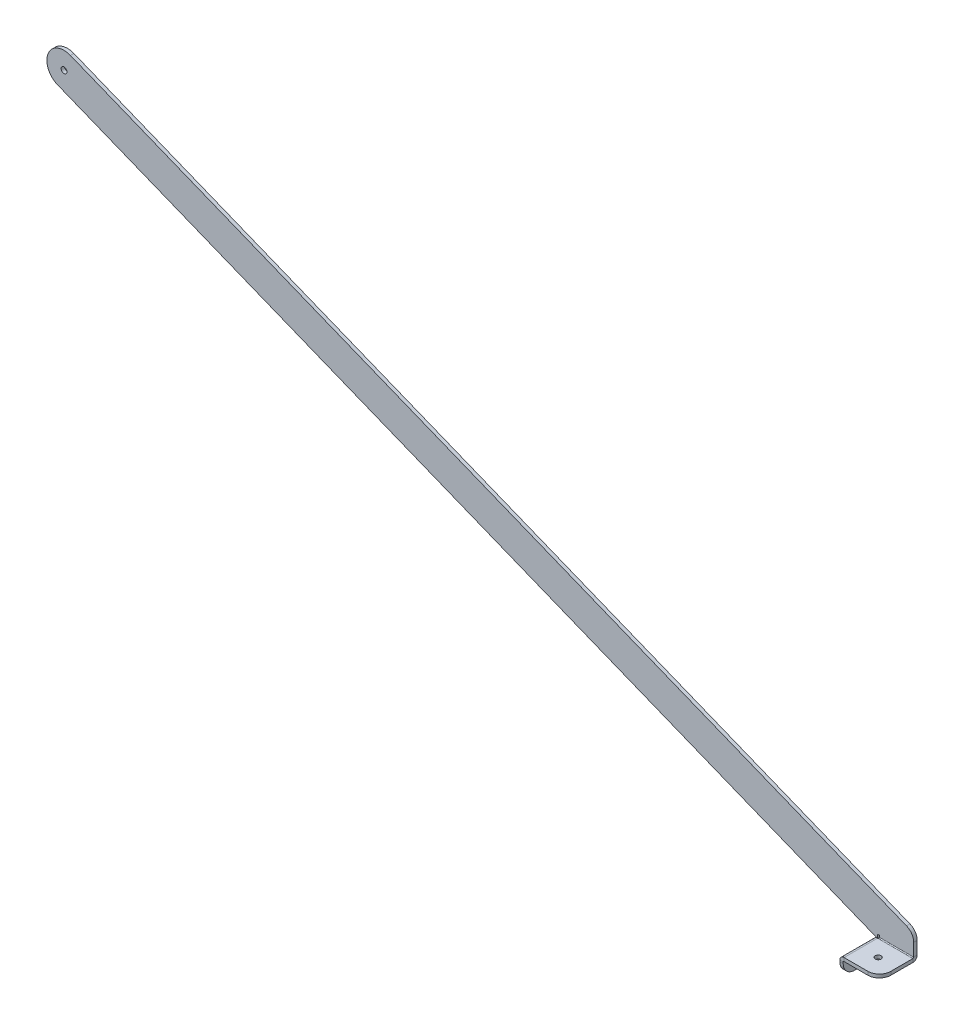
from build123d import *

# Parameters (mm, degrees)
SKETCH1_R                      = 2.55
BASE_FLANGE1_DEPTH             = 3
EDGE_FLANGE1_STRIP_W           = 14.8732
EDGE_FLANGE1_STRIP_H           = 3
EDGE_FLANGE1_STRIP_CUT_DEPTH   = 30
EDGE_FLANGE1_RELIEF_W          = 16.3732
EDGE_FLANGE1_RELIEF_H          = 1.5
EDGE_FLANGE1_RELIEF_CUT_DEPTH  = 3
EDGE_FLANGE1_DEPTH             = 30
EDGE_FLANGE2_DEPTH             = 29.2634
FILLET1_R                      = 10
F_5_1_5_1_DIAMETER_HOLE1_D     = 5.1
F_5_1_5_1_DIAMETER_HOLE1_DEPTH = 10
F_5_1_5_1_DIAMETER_HOLE1_TIP   = 1.532194579


# Sheet-metal steps are written as plain solids
with BuildPart() as part:
    # Sketch1 → Base-Flange1 (new body)
    with BuildSketch(Plane.XY):
        with BuildLine():
            Line((358.5885, -144.00735), (-358.5885, 144.00735))
            ThreePointArc((-358.5885, 144.00735), (-366.917987263, 163.516825696), (-347.408511566, 171.846312959))
            Line((-347.408511566, 171.846312959), (382.315162811, -121.207068785))
            ThreePointArc((382.315162811, -121.207068785), (386.873022561, -124.886126177), (388.5885, -130.486723104))
            Line((388.5885, -130.486723104), (388.5885, -144.00735))
            Line((388.5885, -144.00735), (358.5885, -144.00735))
        make_face()
        with Locations((-352.998505783, 157.926831479)):
            Circle(SKETCH1_R, mode=Mode.SUBTRACT)
    extrude(amount=-BASE_FLANGE1_DEPTH)

    # Edge-Flange1 strip (across the edge) → Edge-Flange1 strip cut (cut)
    with BuildSketch(Plane(origin=(358.5885, -145.40735, 0), x_dir=(0, 1, 0), z_dir=(1, 0, 0))):
        with Locations((-3.7, -1.5)):
            Rectangle(EDGE_FLANGE1_STRIP_W, EDGE_FLANGE1_STRIP_H)
    extrude(amount=EDGE_FLANGE1_STRIP_CUT_DEPTH, mode=Mode.SUBTRACT)

    # Edge-Flange1 relief (on the sheet) → Edge-Flange1 relief cut (cut)
    with BuildSketch(Plane(origin=(358.5885, -141.67075, 0), x_dir=(0, 1, 0), z_dir=(0, 0, 1))):
        with Locations((-6.6866, 0.75)):
            Rectangle(EDGE_FLANGE1_RELIEF_W, EDGE_FLANGE1_RELIEF_H)
    extrude(amount=-EDGE_FLANGE1_RELIEF_CUT_DEPTH, mode=Mode.SUBTRACT)

    # Edge-Flange1 section (across the edge) → Edge-Flange1 (add)
    with BuildSketch(Plane(origin=(358.5885, -145.40735, 0), x_dir=(0, 1, 0), z_dir=(1, 0, 0))):
        with BuildLine():
            Line((0, 0.7366), (0, 30))
            Line((0, 30), (3, 30))
            Line((3, 30), (3, 0.7366))
            ThreePointArc((3, 0.7366), (3.215745145, 0.215745145), (3.7366, 0))
            Line((3.7366, 0), (3.7366, -3))
            ThreePointArc((3.7366, -3), (1.094424801, -1.905575199), (0, 0.7366))
        make_face()
    extrude(amount=EDGE_FLANGE1_DEPTH)

    # Edge-Flange2 section (across the edge) → Edge-Flange2 (add)
    with BuildSketch(Plane(origin=(357.0519, -145.40735, 30), x_dir=(1, 0, 0), z_dir=(0, 0, -1))):
        with BuildLine():
            Line((-3, 0.7366), (-3, 12))
            Line((-3, 12), (0, 12))
            Line((0, 12), (0, 0.7366))
            ThreePointArc((0, 0.7366), (0.215745145, 0.215745145), (0.7366, 0))
            Line((0.7366, 0), (1.5366, 0))
            Line((1.5366, 0), (1.5366, -3))
            Line((1.5366, -3), (0.7366, -3))
            ThreePointArc((0.7366, -3), (-1.905575199, -1.905575199), (-3, 0.7366))
        make_face()
    extrude(amount=EDGE_FLANGE2_DEPTH)

    # Fillet1
    fillet1_edges = [part.edges().sort_by_distance(p)[0] for p in [
        (388.5885, -143.90735, 30),
        (355.5519, -157.40735, 30),
        (355.5519, -157.40735, 0.7366),
    ]]
    fillet(fillet1_edges, radius=FILLET1_R)

    # Ø5.1 (5.1) Diameter Hole1
    with Locations(Plane(origin=(0, -142.40735, 0), x_dir=(1, 0, 0), z_dir=(0, 1, 0))):
        with Locations((372.5585, -15)):
            Hole(F_5_1_5_1_DIAMETER_HOLE1_D / 2, depth=F_5_1_5_1_DIAMETER_HOLE1_DEPTH)
            with Locations((0, 0, -(F_5_1_5_1_DIAMETER_HOLE1_DEPTH + F_5_1_5_1_DIAMETER_HOLE1_TIP / 2))):  # 118° drill point
                Cone(0, F_5_1_5_1_DIAMETER_HOLE1_D / 2, F_5_1_5_1_DIAMETER_HOLE1_TIP, mode=Mode.SUBTRACT)


solid = part.part
